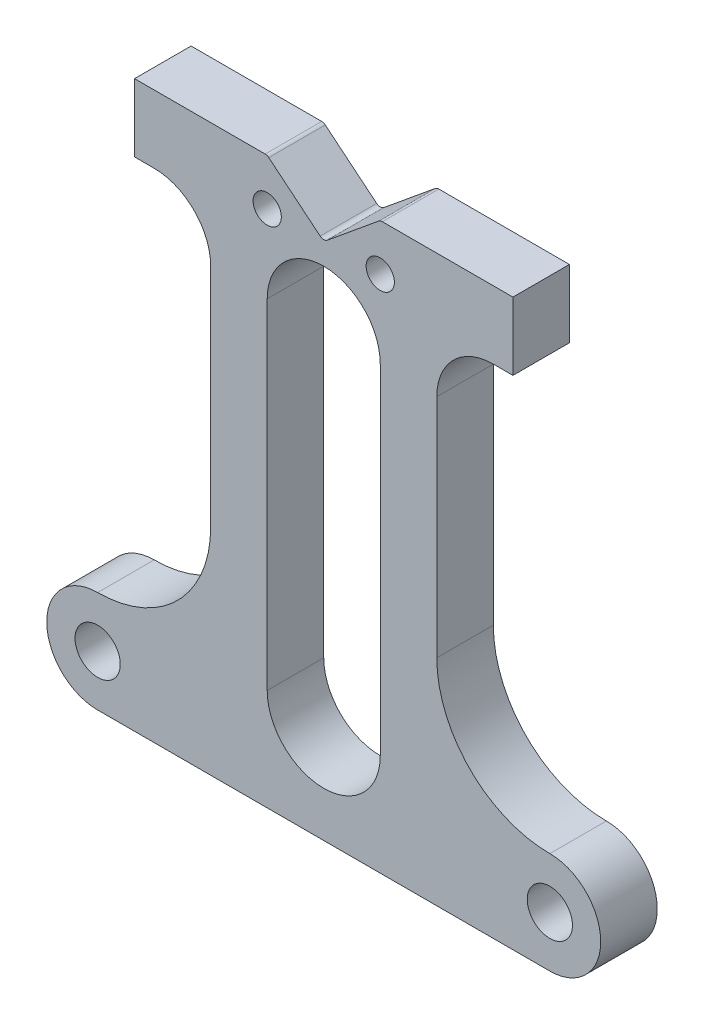
from build123d import *

# Parameters (mm, degrees)
SKETCH1_R           = 2.5
SKETCH1_R_2         = 4
BOSS_EXTRUDE1_DEPTH = 5
FILLET1_R           = 1


with BuildPart() as part:
    # Sketch1 → Boss-Extrude1 (new, symmetric)
    with BuildSketch(Plane.XY):
        with BuildLine():
            ThreePointArc((10, 9), (7.071067812, 1.928932188), (0, -1))
            Line((0, -1), (0, -9))
            Line((0, -9), (40, -9))
            ThreePointArc((40, -9), (49, 0), (40, 9))
            ThreePointArc((40, 9), (25.857864376, 14.857864376), (20, 29))
            Line((20, 29), (20, 69))
            ThreePointArc((20, 69), (22.928932188, 76.071067812), (30, 79))
            Line((30, 79), (33.47, 79))
            Line((33.47, 79), (33.47, 91))
            Line((33.47, 91), (10, 91))
            Line((10, 91), (0, 82.776266062))
            Line((0, 82.776266062), (0, 79))
            ThreePointArc((0, 79), (7.071067812, 76.071067812), (10, 69))
            Line((10, 69), (10, 9))
        make_face()
        with Locations((10, 82.776266062)):
            Circle(SKETCH1_R, mode=Mode.SUBTRACT)
        with Locations((40, 0)):
            Circle(SKETCH1_R_2, mode=Mode.SUBTRACT)
    boss_extrude1 = extrude(amount=BOSS_EXTRUDE1_DEPTH, both=True)

    # Mirror1: Boss-Extrude1 across plane
    add(boss_extrude1.mirror(Plane(origin=(0, 0, 5), x_dir=(0, 0, 1), z_dir=(-1, 0, 0))))

    # Fillet1
    fillet1_edges = [part.edges().sort_by_distance(p)[0] for p in [
        (-10, 91, 0),
        (10, 91, 0),
        (0, 82.776266062, 0),
    ]]
    fillet(fillet1_edges, radius=FILLET1_R)


solid = part.part
